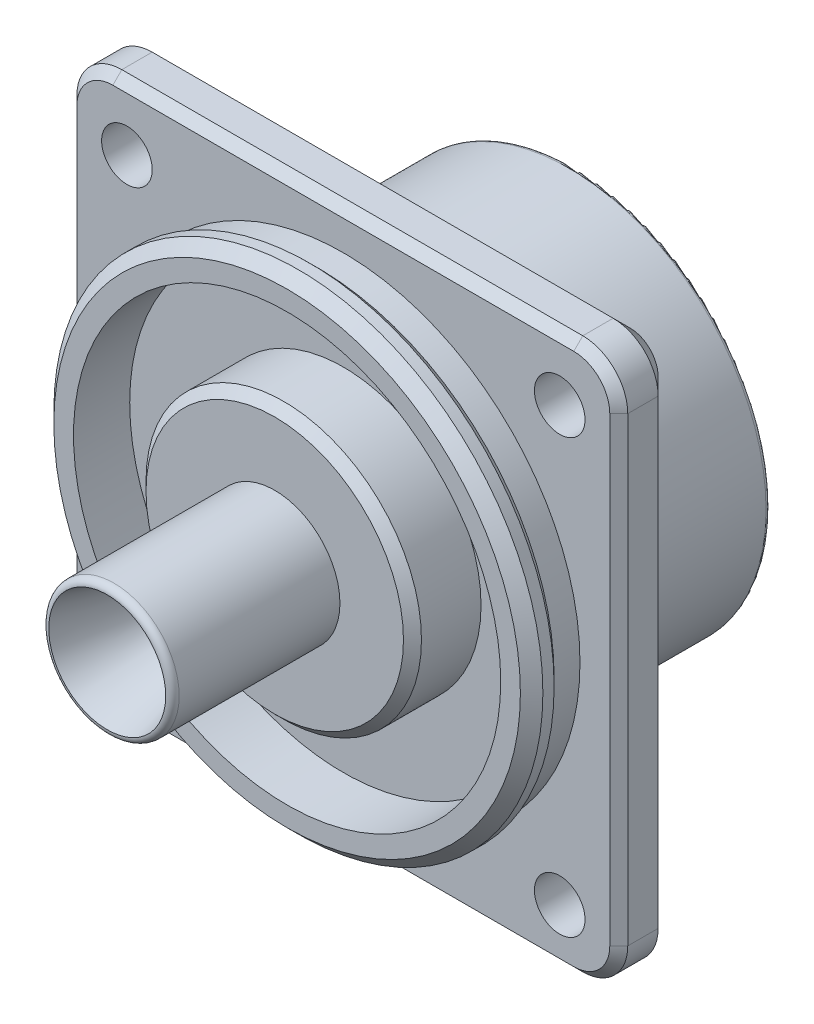
from build123d import *

# Parameters (mm, degrees)
FILLET_3_R          = 0.6
SKETCH_2_W          = 49
SKETCH_2_H          = 5
EXTRUDE_1_DEPTH     = 24.5
FILLET_4_R          = 4
CHAMFER_3_SIZE      = 1.5
CHAMFER_4_SIZE      = 1
SKETCH_3_R          = 3
CUT_EXTRUDE_1_DEPTH = 55.062463873
SKETCH_4_R          = 2.25
CUT_EXTRUDE_2_DEPTH = 55.062463873
SKETCH_5_R          = 2
CUT_EXTRUDE_3_DEPTH = 9
FILLET_7_R          = 0.4
CHAMFER_5_SIZE      = 0.8
CHAMFER_6_SIZE      = 0.8
CHAMFER_7_SIZE      = 0.8


# Read off the part's stored shape, not the designer's step: 旋转1
# Some blends are built 0.0001 mm under size
with BuildPart() as part:
    # 旋转1 outline → 旋转1 (revolve)
    with BuildSketch(Plane.XZ):
        Polygon((3.9, -35.644445464), (3.9, -34.544445464), (5.85, -34.544445464), (5.85, -35.644445464), (17.5, -35.644445464), (17.5, -20.144445464), (24.5, -20.144445464), (24.5, -15.144445464), (21.05, -15.144445464), (21.05, -12.944445464), (21.75, -12.944445464), (21.75, -10.144445464), (19, -10.144445464), (19, -17.144445464), (12.25, -17.144445464), (12.25, -9.044445464), (5.8, -9.044445464), (5.8, 5.855554536), (5.2, 5.855554536), (0, -13.053536373), (0, -35.644445464), align=None)
    revolve(axis=Axis((0, 0, 0), (0, 0, 1)))

    # 圆角3
    fillet_3_edges = [part.edges().sort_by_distance(p)[0] for p in [
        (-5.8, 0, 5.855554536),
    ]]
    fillet(fillet_3_edges, radius=FILLET_3_R - 0.0001)  # a hair under: the kernel refuses the full size

    # 草图2 → 凸台-拉伸1 (add, symmetric)
    with BuildSketch(Plane(origin=(0, 0, 0), x_dir=(1, 0, 0), z_dir=(0, 1, 0))):
        with Locations((0, 17.644445464)):
            Rectangle(SKETCH_2_W, SKETCH_2_H)
    extrude(amount=EXTRUDE_1_DEPTH, both=True)

    # 圆角4
    fillet_4_edges = [part.edges().sort_by_distance(p)[0] for p in [
        (24.5, -24.5, -17.644445464),
        (-24.5, 24.5, -17.644445464),
        (-24.5, -24.5, -17.644445464),
        (24.5, 24.5, -17.644445464),
    ]]
    fillet(fillet_4_edges, radius=FILLET_4_R)

    # 倒角3
    chamfer_3_edges = [part.edges().sort_by_distance(p)[0] for p in [
        (0, 24.5, -20.144445464),
        (-24.5, 0, -20.144445464),
        (24.5, 0, -20.144445464),
        (0, -24.5, -20.144445464),
        (23.328427125, 23.328427125, -20.144445464),
        (23.328427125, -23.328427125, -20.144445464),
        (-23.328427125, -23.328427125, -20.144445464),
        (-23.328427125, 23.328427125, -20.144445464),
    ]]
    chamfer(chamfer_3_edges, length=CHAMFER_3_SIZE)

    # 倒角4
    chamfer_4_edges = [part.edges().sort_by_distance(p)[0] for p in [
        (-21.75, 0, -10.144445464),
    ]]
    chamfer(chamfer_4_edges, length=CHAMFER_4_SIZE)

    # 草图3 → 切除-拉伸1 (cut, through all)
    with BuildSketch(Plane(origin=(0, 0, -35.644445464), x_dir=(-1, 0, 0), z_dir=(0, 0, -1))):
        Circle(SKETCH_3_R)
    extrude(amount=-CUT_EXTRUDE_1_DEPTH, mode=Mode.SUBTRACT)

    # 草图4 → 切除-拉伸2 (cut, through all)
    with BuildSketch(Plane(origin=(0, 0, -35.644445464), x_dir=(-1, 0, 0), z_dir=(0, 0, -1))):
        with Locations((-19.25, 18.931846081)):
            Circle(SKETCH_4_R)
        with Locations((19.25, 18.931846081)):
            Circle(SKETCH_4_R)
        with Locations((-19.25, -19.568153919)):
            Circle(SKETCH_4_R)
        with Locations((19.25, -19.568153919)):
            Circle(SKETCH_4_R)
    extrude(amount=-CUT_EXTRUDE_2_DEPTH, mode=Mode.SUBTRACT)

    # 草图5 → 切除-拉伸3 (cut)
    with BuildSketch(Plane(origin=(0, 0, -35.644445464), x_dir=(-1, 0, 0), z_dir=(0, 0, -1))):
        with Locations((-8.5, 8.5)):
            Circle(SKETCH_5_R)
        with Locations((8.5, 8.5)):
            Circle(SKETCH_5_R)
        with Locations((8.5, -8.5)):
            Circle(SKETCH_5_R)
        with Locations((-8.5, -8.5)):
            Circle(SKETCH_5_R)
    extrude(amount=-CUT_EXTRUDE_3_DEPTH, mode=Mode.SUBTRACT)

    # 圆角7
    fillet_7_edges = [part.edges().sort_by_distance(p)[0] for p in [
        (-17.5, 0, -35.644445464),
    ]]
    fillet(fillet_7_edges, radius=FILLET_7_R)

    # 倒角5
    chamfer_5_edges = [part.edges().sort_by_distance(p)[0] for p in [
        (-12.25, 0, -9.044445464),
    ]]
    chamfer(chamfer_5_edges, length=CHAMFER_5_SIZE)

    # 倒角6
    # the kernel refuses this chamfer: 0.8 mm, written as the material it takes off along each edge
    with BuildSketch(Plane(origin=(0, 0, -12.944445464), x_dir=(1, 0, 0), z_dir=(0, -1, 0))) as chamfer_6_piece_1_section:
        Polygon((21.75, CHAMFER_6_SIZE), (21.75 - CHAMFER_6_SIZE, 0), (21.75, 0), align=None)
    chamfer_6_piece_1 = revolve(axis=Axis((0, 0, -12.944445464), (0, 0, 1)), mode=Mode.PRIVATE)
    chamfer_6_piece_1 = chamfer_6_piece_1 - Plane(origin=(0, 0, -12.50853459), x_dir=(1, 0, 0), z_dir=(0, 0, 1)) * Cylinder(21.05, 87, mode=Mode.PRIVATE)
    add(chamfer_6_piece_1, mode=Mode.SUBTRACT)

    # 倒角7
    chamfer_7_edges = [part.edges().sort_by_distance(p)[0] for p in [
        (0, 24.5, -15.144445464),
        (24.5, 0, -15.144445464),
        (-24.5, 0, -15.144445464),
        (0, -24.5, -15.144445464),
        (23.328427125, 23.328427125, -15.144445464),
        (23.328427125, -23.328427125, -15.144445464),
        (-23.328427125, -23.328427125, -15.144445464),
        (-23.328427125, 23.328427125, -15.144445464),
    ]]
    chamfer(chamfer_7_edges, length=CHAMFER_7_SIZE)


solid = part.part
